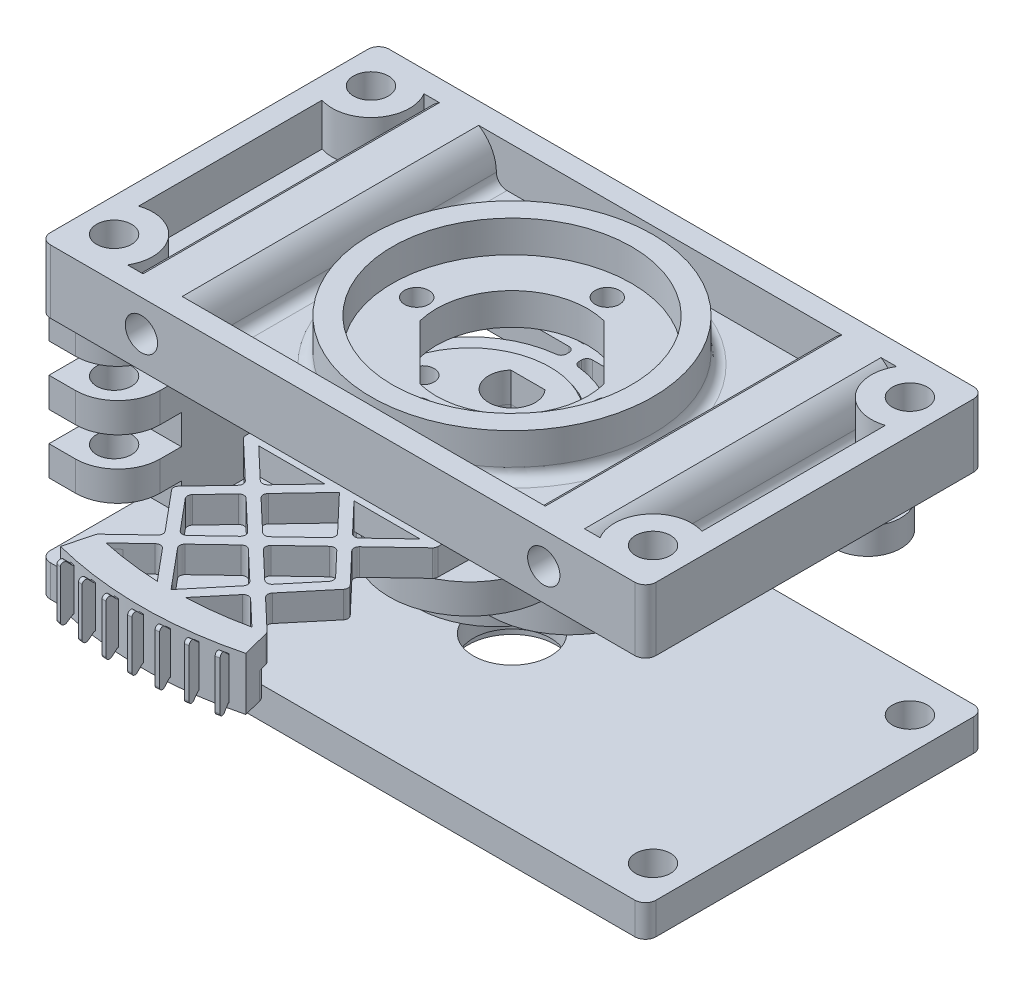
from build123d import *

# Parameters (mm, degrees)
SKETCH4_R                       = 7.8
SKETCH4_R_2                     = 1.65
SKETCH4_W                       = 21.7
SKETCH4_H                       = 1.5
BOSS_EXTRUDE1_DEPTH             = 2.5
EXTRUDE_THIN2_DEPTH             = 2.5
EXTRUDE_THIN2_DEPTH_BACK        = 2.5
EXTRUDE_THIN6_DEPTH             = 2.5
SKETCH7_R                       = 7.6
SKETCH7_R_2                     = 1.1
SKETCH7_R_3                     = 2.2
BOSS_EXTRUDE2_DEPTH             = 2.8
SKETCH7_5_R                     = 7.6
SKETCH7_5_R_2                   = 1.1
SKETCH7_5_R_3                   = 2.2
BOSS_EXTRUDE3_DEPTH             = 2.8
BOSS_EXTRUDE4_START             = -2.8
SKETCH7_6_R                     = 7.6
SKETCH7_6_R_2                   = 1.1
SKETCH7_6_R_3                   = 2.2
BOSS_EXTRUDE4_DEPTH             = 2.8
BOSS_EXTRUDE5_START             = -5.6
SKETCH7_8_R                     = 7.6
SKETCH7_8_R_2                   = 1.1
SKETCH7_8_R_3                   = 2.2
BOSS_EXTRUDE5_DEPTH             = 2.8
BOSS_EXTRUDE6_START             = -8.4
SKETCH7_9_R                     = 7.6
SKETCH7_9_R_2                   = 1.1
SKETCH7_9_R_3                   = 2.2
BOSS_EXTRUDE6_DEPTH             = 2.8
BOSS_EXTRUDE10_START            = -11.2
SKETCH7_10_R                    = 7.6
SKETCH7_10_R_2                  = 1.1
SKETCH7_10_R_3                  = 2.2
BOSS_EXTRUDE10_DEPTH            = 2.8
SKETCH8_W                       = 57.2
SKETCH8_H                       = 32
SKETCH8_R                       = 1.65
BOSS_EXTRUDE7_DEPTH             = 6
CUT_EXTRUDE5_START              = 3
SKETCH9_2_R                     = 11.3
CUT_EXTRUDE5_DEPTH              = 46.220327664
SKETCH9_3_R                     = 1.15
CUT_EXTRUDE6_DEPTH              = 49.220327664
CUT_EXTRUDE1_DEPTH              = 61.12453742
CUT_EXTRUDE1_DEPTH_BACK         = 61.12453742
SKETCH10_R                      = 1.525
FILLET2_R                       = 1
FILLET1_R                       = 0.5
SKETCH12_R                      = 3.15
SKETCH12_R_2                    = 1.65
BOSS_EXTRUDE9_DEPTH             = 2.8
BOSS_EXTRUDE11_START            = -20
SKETCH8_4_W                     = 57.2
SKETCH8_4_H                     = 32
SKETCH8_4_R                     = 1.65
BOSS_EXTRUDE11_DEPTH            = 3
SKETCH13_R                      = 3.65
CUT_EXTRUDE2_DEPTH              = 3
SKETCH13_3_R                    = 4.15
SKETCH13_3_R_2                  = 3.65
CUT_EXTRUDE3_DEPTH              = 0.8
SKETCH14_W                      = 9.130624979
SKETCH14_H                      = 2.8
SKETCH14_W_2                    = 18.261249958
SKETCH14_W_3                    = 6
BOSS_EXTRUDE13_DEPTH            = 6.5
SKETCH8_5_R                     = 1.65
CUT_EXTRUDE4_DEPTH              = 51.714494969
FILLET3_R                       = 4
BOSS_EXTRUDE16_DEPTH            = 2.8
BOSS_EXTRUDE17_DEPTH            = 2.8
BOSS_EXTRUDE18_START            = -2.8
BOSS_EXTRUDE18_DEPTH            = 2.8
BOSS_EXTRUDE19_START            = -5.6
BOSS_EXTRUDE19_DEPTH            = 2.8
BOSS_EXTRUDE20_START            = -8.4
BOSS_EXTRUDE20_DEPTH            = 2.8
BOSS_EXTRUDE21_START            = -11.2
BOSS_EXTRUDE21_DEPTH            = 2.8
SHELL1_START                    = -8.480624879
SHELL1_DEPTH                    = 16.961249758
SHELL1_START_2                  = -14
SHELL1_2_DEPTH                  = 0.6999999
SHELL1_START_3                  = 13.3000001
SHELL1_3_DEPTH                  = 0.6999999
SHELL1_4_DEPTH                  = 28
SHELL1_START_4                  = 4.8
SHELL1_5_OUTLINE_R              = 13.3
SHELL1_5_OUTLINE_R_2            = 11.3
SHELL1_5_DEPTH                  = 4
SHELL1_6_OUTLINE_R              = 11.3
SHELL1_6_OUTLINE_R_2            = 1.15
SHELL1_6_DEPTH                  = 1
SKETCH16_R                      = 0.5
CUT_EXTRUDE8_DEPTH              = 0.2
SKETCH16_2_R                    = 0.5
BOSS_EXTRUDE22_DEPTH            = 0.2
FILLET5_R                       = 0.5
FILLET6_R                       = 0.3
CIRPATTERN2_COUNT               = 4
CIRPATTERN2_ANGLE               = 12
CIRPATTERN2_THE_OTHER_WAY_COUNT = 4
CIRPATTERN2_THE_OTHER_WAY_ANGLE = 12
CIRPATTERN3_ANGLE               = 12
CIRPATTERN3_2_ANGLE             = 8
CIRPATTERN3_3_ANGLE             = 4
CIRPATTERN3_4_ANGLE             = 12
CIRPATTERN3_5_ANGLE             = 8
CIRPATTERN3_6_ANGLE             = 4
SHELL2_START                    = -20.2
SHELL2_OUTLINE_R                = 5.65
SHELL2_DEPTH                    = 1.5
FILLET7_R                       = 1
FILLET8_R                       = 1
FILLET9_R                       = 1
FILLET10_R                      = 1
FILLET11_R                      = 1
FILLET12_R                      = 10


with BuildPart() as part:
    # Sketch4 → Boss-Extrude1 (new body)
    with BuildSketch(Plane(origin=(0, 0, 0), x_dir=(1, 0, 0), z_dir=(0, 1, 0))):
        with BuildLine():
            Line((0.6, 6.480624979), (22.766718427, 6.480624979))
            ThreePointArc((22.766718427, 6.480624979), (28.6, 8.130624979), (22.766718427, 9.780624979))
            Line((22.766718427, 9.780624979), (-22.766718427, 9.780624979))
            ThreePointArc((-22.766718427, 9.780624979), (-28.6, 8.130624979), (-22.766718427, 6.480624979))
            Line((-22.766718427, 6.480624979), (-0.6, 6.480624979))
            Line((-0.6, 6.480624979), (-0.6, 5.280624979))
            ThreePointArc((-0.6, 5.280624979), (-6.843303138, 2.297555253), (-9.298416736, -4.171598965))
            Line((-9.298416736, -4.171598965), (-9.07459142, -16.3))
            Line((-9.07459142, -16.3), (9.07459142, -16.3))
            Line((9.07459142, -16.3), (9.298416736, -4.171598965))
            ThreePointArc((9.298416736, -4.171598965), (6.843303138, 2.297555253), (0.6, 5.280624979))
            Line((0.6, 5.280624979), (0.6, 6.480624979))
        make_face()
        with Locations(Location((0, -4, 0), (0, 0, 270))):
            Circle(SKETCH4_R, mode=Mode.SUBTRACT)
        with Locations(Location((-25.45, 8.130624979, 0), (0, 0, 270))):
            Circle(SKETCH4_R_2, mode=Mode.SUBTRACT)
        with Locations((-11.45, 8.130624979)):
            Rectangle(SKETCH4_W, SKETCH4_H, mode=Mode.SUBTRACT)
        with Locations((11.45, 8.130624979)):
            Rectangle(SKETCH4_W, SKETCH4_H, mode=Mode.SUBTRACT)
        with Locations(Location((25.45, 8.130624979, 0), (0, 0, 270))):
            Circle(SKETCH4_R_2, mode=Mode.SUBTRACT)
    extrude(amount=BOSS_EXTRUDE1_DEPTH)



with BuildPart() as body_2:
    # Sketch4<5> → Extrude-Thin2 (new, two sides: drawn at the far end of the back side and taken through both)
    with BuildSketch(Plane(origin=(0, 0, 0), x_dir=(1, 0, 0), z_dir=(0, 1, 0)).offset(-EXTRUDE_THIN2_DEPTH_BACK)):
        with BuildLine():
            ThreePointArc((-8.75, -33.888604279), (0, -35), (8.75, -33.888604279))
            Line((8.75, -33.888604279), (8.05, -31.177515937))
            ThreePointArc((8.05, -31.177515937), (0, -32.2), (-8.05, -31.177515937))
            Line((-8.05, -31.177515937), (-8.75, -33.888604279))
        make_face()
    extrude(amount=EXTRUDE_THIN2_DEPTH + EXTRUDE_THIN2_DEPTH_BACK)


with BuildPart() as part_1:
    add(part.part)

    add(body_2.part)  # Extrude-Thin6 merges body 2
    # Sketch5 → Extrude-Thin6 (add)
    with BuildSketch(Plane(origin=(0, 0, 0), x_dir=(1, 0, 0), z_dir=(0, 1, 0))):
        Polygon((-8.05, -31.177515937), (8.386109532, -15.574746465), (9.07459142, -16.3), (-7.361518112, -31.902769472), align=None)
        Polygon((0, -16.3), (-7.06229571, -23.738757968), (0, -32.2), (-0.767718557, -32.840787186), (-8.400567994, -23.695972364), (-0.725219651, -15.61148242), align=None)
    extrude_thin6 = extrude(amount=EXTRUDE_THIN6_DEPTH)

    # Mirror1: Extrude-Thin6 across plane
    add(extrude_thin6.mirror(Plane(origin=(0, 0, 0), x_dir=(0, 0, 1), z_dir=(1, 0, 0))))

    # Fillet2
    fillet2_edges = [part_1.edges().sort_by_distance(p)[0] for p in [
        (-8.05, -1.25, 31.177515937),
        (8.05, -1.25, 31.177515937),
    ]]
    fillet(fillet2_edges, radius=FILLET2_R)

    # Fillet1
    fillet1_edges = [part_1.edges().sort_by_distance(p)[0] for p in [
        (-4.761566269, 1.25, 28.05581166),
        (-4.119469828, 1.25, 28.825098817),
        (-3.392734457, 1.25, 28.135210225),
        (-8.400567994, 1.25, 23.695972364),
        (-4.034830898, 1.25, 27.365923067),
        (-7.06229571, 1.25, 23.738757968),
        (-3.613128083, 1.25, 20.105729244),
        (-4.301645663, 1.25, 20.830948896),
        (5.026899199, 1.25, 20.142467008),
        (4.338381619, 1.25, 19.417247356),
        (8.400567994, 1.25, 23.695972364),
        (0, 1.25, 24.914493454),
        (3.392734457, 1.25, 28.135210225),
        (-5.026899199, 1.25, 20.142467008),
        (-4.338381619, 1.25, 19.417247356),
        (0, 1.25, 23.535665291),
        (0.726235517, 1.25, 24.225079372),
        (3.613128083, 1.25, 20.105729244),
        (4.301645663, 1.25, 20.830948896),
        (-0.726235517, 1.25, 24.225079372),
        (4.761566269, 1.25, 28.05581166),
        (8.05, 1.25, 31.177515937),
        (4.034830898, 1.25, 27.365923067),
        (7.06229571, 1.25, 23.738757968),
        (4.119469828, 1.25, 28.825098817),
        (22.766718427, 1.25, -9.780624979),
        (22.766718427, 1.25, -6.480624979),
        (0.6, 1.25, -6.480624979),
        (0.6, 1.25, -5.280624979),
        (9.07459142, 1.25, 16.3),
        (-9.07459142, 1.25, 16.3),
        (-0.6, 1.25, -5.280624979),
        (-0.6, 1.25, -6.480624979),
        (-22.766718427, 1.25, -6.480624979),
        (-22.766718427, 1.25, -9.780624979),
        (-8.05, 1.25, 31.177515937),
    ]]
    fillet(fillet1_edges, radius=FILLET1_R)

    # Sketch16 → Cut-Extrude8 (cut, symmetric)
    with BuildSketch(Plane(origin=(0, 0, 0), x_dir=(0, 0, -1), z_dir=(1, 0, 0))):
        Polygon((-35.1, 2), (-32.1, 2), (-32.1, -2), (-35.1, -2), (-36.1, -3), (-36.1, 3), align=None)
        with Locations((-33.6, 0)):
            Circle(SKETCH16_R, mode=Mode.SUBTRACT)
    cut_extrude8 = extrude(amount=CUT_EXTRUDE8_DEPTH, both=True, mode=Mode.SUBTRACT)

    # CirPattern2: Cut-Extrude8 ×4 about axis
    cirpattern2_axis = Axis((0, 0, 0), (0, 1, 0))
    for i in range(1, CIRPATTERN2_COUNT):
        add(cut_extrude8.rotate(cirpattern2_axis, i * CIRPATTERN2_ANGLE / (CIRPATTERN2_COUNT - 1)), mode=Mode.SUBTRACT)

    # CirPattern2 the other way: Cut-Extrude8 ×4 about axis
    cirpattern2_the_other_way_axis = Axis((0, 0, 0), (0, -1, 0))
    for i in range(1, CIRPATTERN2_THE_OTHER_WAY_COUNT):
        add(cut_extrude8.rotate(cirpattern2_the_other_way_axis, i * CIRPATTERN2_THE_OTHER_WAY_ANGLE / (CIRPATTERN2_THE_OTHER_WAY_COUNT - 1)), mode=Mode.SUBTRACT)

    # Fillet12
    # the kernel refuses this fillet: 10 mm, written as the material it takes off along each edge
    with BuildSketch(Plane(origin=(0.083466419, 2, 32.1), x_dir=(1, 0, 0), z_dir=(0, -1, 0))) as fillet12_piece_1:
        with BuildLine():
            CenterArc((8.580263092, 5.325906756), FILLET12_R, 212.180664035, 7.669879004)
            Line((0.903077523, -1.081965102), (0, 0))
            Line((0, 0), (0.116533581, 0))
        make_face()
    extrude(amount=5.523312979, mode=Mode.SUBTRACT)
    with BuildSketch(Plane(origin=(-0.083466419, 2, 32.1), x_dir=(-0.6407871858448472, 0, -0.7677185568012806), z_dir=(0, -1, 0))) as fillet12_piece_2:
        with BuildLine():
            CenterArc((1.409325192, -10), FILLET12_R, 90, 7.669879004)
            Line((0.074673226, -0.089464993), (0, 0))
            Line((0, 0), (1.409325192, 0))
        make_face()
    extrude(amount=5.523312979, mode=Mode.SUBTRACT)
    with BuildSketch(Plane(origin=(6.80174475, 2, 31.371377618), x_dir=(0.9781476007336182, 0, -0.20791169081864166), z_dir=(0, -1, 0))) as fillet12_piece_3:
        with BuildLine():
            CenterArc((7.659845043, -6.510347586), FILLET12_R, 139.380336254, 6.129720691)
            Line((-0.582410911, -0.847731867), (0, 0))
            Line((0, 0), (0.069365856, 0))
        make_face()
    extrude(amount=4.571298051, mode=Mode.SUBTRACT)
    with BuildSketch(Plane(origin=(-6.80174475, 2, 31.371377618), x_dir=(0.7252535351516691, 0, -0.6884818877428851), z_dir=(0, -1, 0))) as fillet12_piece_4:
        with BuildLine():
            CenterArc((1.028519221, -10), FILLET12_R, 90, 6.129720691)
            Line((-0.039279218, -0.057173114), (0, 0))
            Line((0, 0), (1.028519221, 0))
        make_face()
    extrude(amount=4.571298051, mode=Mode.SUBTRACT)


with BuildPart() as body_2_2:
    # Sketch7 → Boss-Extrude2 (new body)
    with BuildSketch(Plane(origin=(0, 0, 0), x_dir=(1, 0, 0), z_dir=(0, 1, 0))):
        with Locations(Location((0, -4, 0), (0, 0, 270))):
            Circle(SKETCH7_R)
        with Locations(Location((5.354034834, -3.091153453, 0), (0, 0, 270))):
            Circle(SKETCH7_R_2, mode=Mode.SUBTRACT)
        with Locations(Location((-5.354034834, -3.091153453, 0), (0, 0, 270))):
            Circle(SKETCH7_R_2, mode=Mode.SUBTRACT)
        with Locations(Location((0, 0, 0), (0, 0, 270))):
            Circle(SKETCH7_R_3, mode=Mode.SUBTRACT)
    extrude(amount=BOSS_EXTRUDE2_DEPTH)

    # Sketch7<12> → Boss-Extrude16 (add)
    with BuildSketch(Plane(origin=(0, 0, 0), x_dir=(1, 0, 0), z_dir=(0, 1, 0))):
        with BuildLine():
            ThreePointArc((1.609347694, 1.5), (0, 2.2), (-1.609347694, 1.5))
            Line((-1.609347694, 1.5), (1.609347694, 1.5))
        make_face()
    extrude(amount=BOSS_EXTRUDE16_DEPTH)


with BuildPart() as body_3:
    # Sketch7<5> → Boss-Extrude3 (new body)
    with BuildSketch(Plane(origin=(0, 0, 0), x_dir=(1, 0, 0), z_dir=(0, 1, 0))):
        with Locations(Location((3.464101615, 2, 0), (0, 0, 270))):
            Circle(SKETCH7_5_R)
        with Locations(Location((0, 6.182306905, 0), (0, 0, 270))):
            Circle(SKETCH7_5_R_2, mode=Mode.SUBTRACT)
        with Locations(Location((5.354034834, -3.091153453, 0), (0, 0, 270))):
            Circle(SKETCH7_5_R_2, mode=Mode.SUBTRACT)
        with Locations(Location((0, 0, 0), (0, 0, 270))):
            Circle(SKETCH7_5_R_3, mode=Mode.SUBTRACT)
    extrude(amount=-BOSS_EXTRUDE3_DEPTH)

    # Sketch7<14> → Boss-Extrude17 (add)
    with BuildSketch(Plane(origin=(0, 0, 0), x_dir=(1, 0, 0), z_dir=(0, 1, 0))):
        with BuildLine():
            ThreePointArc((1.609347694, 1.5), (0, 2.2), (-1.609347694, 1.5))
            Line((-1.609347694, 1.5), (1.609347694, 1.5))
        make_face()
    extrude(amount=-BOSS_EXTRUDE17_DEPTH)


with BuildPart() as body_4:
    # Sketch7<6> → Boss-Extrude4 (new body)
    with BuildSketch(Plane(origin=(0, 0, 0), x_dir=(1, 0, 0), z_dir=(0, 1, 0)).offset(BOSS_EXTRUDE4_START)):
        with Locations(Location((-3.464101615, 2, 0), (0, 0, 270))):
            Circle(SKETCH7_6_R)
        with Locations(Location((0, 6.182306905, 0), (0, 0, 270))):
            Circle(SKETCH7_6_R_2, mode=Mode.SUBTRACT)
        with Locations(Location((-5.354034834, -3.091153453, 0), (0, 0, 270))):
            Circle(SKETCH7_6_R_2, mode=Mode.SUBTRACT)
        with Locations(Location((0, 0, 0), (0, 0, 270))):
            Circle(SKETCH7_6_R_3, mode=Mode.SUBTRACT)
    extrude(amount=-BOSS_EXTRUDE4_DEPTH)

    # Sketch7<15> → Boss-Extrude18 (add)
    with BuildSketch(Plane(origin=(0, 0, 0), x_dir=(1, 0, 0), z_dir=(0, 1, 0)).offset(BOSS_EXTRUDE18_START)):
        with BuildLine():
            ThreePointArc((1.609347694, 1.5), (0, 2.2), (-1.609347694, 1.5))
            Line((-1.609347694, 1.5), (1.609347694, 1.5))
        make_face()
    extrude(amount=-BOSS_EXTRUDE18_DEPTH)


with BuildPart() as body_5:
    # Sketch7<8> → Boss-Extrude5 (new body)
    with BuildSketch(Plane(origin=(0, 0, 0), x_dir=(1, 0, 0), z_dir=(0, 1, 0)).offset(BOSS_EXTRUDE5_START)):
        with Locations(Location((0, -4, 0), (0, 0, 270))):
            Circle(SKETCH7_8_R)
        with Locations(Location((5.354034834, -3.091153453, 0), (0, 0, 270))):
            Circle(SKETCH7_8_R_2, mode=Mode.SUBTRACT)
        with Locations(Location((-5.354034834, -3.091153453, 0), (0, 0, 270))):
            Circle(SKETCH7_8_R_2, mode=Mode.SUBTRACT)
        with Locations(Location((0, 0, 0), (0, 0, 270))):
            Circle(SKETCH7_8_R_3, mode=Mode.SUBTRACT)
    extrude(amount=-BOSS_EXTRUDE5_DEPTH)

    # Sketch7<16> → Boss-Extrude19 (add)
    with BuildSketch(Plane(origin=(0, 0, 0), x_dir=(1, 0, 0), z_dir=(0, 1, 0)).offset(BOSS_EXTRUDE19_START)):
        with BuildLine():
            ThreePointArc((1.609347694, 1.5), (0, 2.2), (-1.609347694, 1.5))
            Line((-1.609347694, 1.5), (1.609347694, 1.5))
        make_face()
    extrude(amount=-BOSS_EXTRUDE19_DEPTH)


with BuildPart() as body_6:
    # Sketch7<9> → Boss-Extrude6 (new body)
    with BuildSketch(Plane(origin=(0, 0, 0), x_dir=(1, 0, 0), z_dir=(0, 1, 0)).offset(BOSS_EXTRUDE6_START)):
        with Locations(Location((3.464101615, 2, 0), (0, 0, 270))):
            Circle(SKETCH7_9_R)
        with Locations(Location((0, 6.182306905, 0), (0, 0, 270))):
            Circle(SKETCH7_9_R_2, mode=Mode.SUBTRACT)
        with Locations(Location((5.354034834, -3.091153453, 0), (0, 0, 270))):
            Circle(SKETCH7_9_R_2, mode=Mode.SUBTRACT)
        with Locations(Location((0, 0, 0), (0, 0, 270))):
            Circle(SKETCH7_9_R_3, mode=Mode.SUBTRACT)
    extrude(amount=-BOSS_EXTRUDE6_DEPTH)

    # Sketch7<17> → Boss-Extrude20 (add)
    with BuildSketch(Plane(origin=(0, 0, 0), x_dir=(1, 0, 0), z_dir=(0, 1, 0)).offset(BOSS_EXTRUDE20_START)):
        with BuildLine():
            ThreePointArc((1.609347694, 1.5), (0, 2.2), (-1.609347694, 1.5))
            Line((-1.609347694, 1.5), (1.609347694, 1.5))
        make_face()
    extrude(amount=-BOSS_EXTRUDE20_DEPTH)


with BuildPart() as body_7:
    # Sketch7<10> → Boss-Extrude10 (new body)
    with BuildSketch(Plane(origin=(0, 0, 0), x_dir=(1, 0, 0), z_dir=(0, 1, 0)).offset(BOSS_EXTRUDE10_START)):
        with Locations(Location((-3.464101615, 2, 0), (0, 0, 270))):
            Circle(SKETCH7_10_R)
        with Locations(Location((0, 6.182306905, 0), (0, 0, 270))):
            Circle(SKETCH7_10_R_2, mode=Mode.SUBTRACT)
        with Locations(Location((-5.354034834, -3.091153453, 0), (0, 0, 270))):
            Circle(SKETCH7_10_R_2, mode=Mode.SUBTRACT)
        with Locations(Location((0, 0, 0), (0, 0, 270))):
            Circle(SKETCH7_10_R_3, mode=Mode.SUBTRACT)
    extrude(amount=-BOSS_EXTRUDE10_DEPTH)

    # Sketch7<18> → Boss-Extrude21 (add)
    with BuildSketch(Plane(origin=(0, 0, 0), x_dir=(1, 0, 0), z_dir=(0, 1, 0)).offset(BOSS_EXTRUDE21_START)):
        with BuildLine():
            ThreePointArc((1.609347694, 1.5), (0, 2.2), (-1.609347694, 1.5))
            Line((-1.609347694, 1.5), (1.609347694, 1.5))
        make_face()
    extrude(amount=-BOSS_EXTRUDE21_DEPTH)


with BuildPart() as body_8:
    # Sketch8 → Boss-Extrude7 (new body)
    with BuildSketch(Plane(origin=(0, 2.8, 0), x_dir=(1, 0, 0), z_dir=(0, 1, 0))):
        Rectangle(SKETCH8_W, SKETCH8_H)
        with Locations(Location((25.45, 12.130624979, 0), (0, 0, 270))):
            Circle(SKETCH8_R, mode=Mode.SUBTRACT)
        with Locations(Location((-25.45, 12.130624979, 0), (0, 0, 270))):
            Circle(SKETCH8_R, mode=Mode.SUBTRACT)
        with Locations(Location((25.45, -12.130624979, 0), (0, 0, 90))):
            Circle(SKETCH8_R, mode=Mode.SUBTRACT)
        with Locations(Location((-25.45, -12.130624979, 0), (0, 0, 90))):
            Circle(SKETCH8_R, mode=Mode.SUBTRACT)
    extrude(amount=BOSS_EXTRUDE7_DEPTH)

    # Sketch9<2> → Cut-Extrude5 (cut, through all)
    with BuildSketch(Plane(origin=(0, 2.8, 0), x_dir=(1, 0, 0), z_dir=(0, 1, 0)).offset(CUT_EXTRUDE5_START)):
        with Locations(Location((0, 0, 0), (0, 0, 270))):
            Circle(SKETCH9_2_R)
    extrude(amount=CUT_EXTRUDE5_DEPTH, mode=Mode.SUBTRACT)

    # Sketch9<3> → Cut-Extrude6 (cut, through all)
    with BuildSketch(Plane(origin=(0, 2.8, 0), x_dir=(1, 0, 0), z_dir=(0, 1, 0))):
        with BuildLine():
            Line((6.927466096, 1.769947313), (1.769947313, 6.927466096))
            ThreePointArc((1.769947313, 6.927466096), (-5.055813485, 5.055813485), (-6.927466096, -1.769947313))
            Line((-6.927466096, -1.769947313), (-1.769947313, -6.927466096))
            ThreePointArc((-1.769947313, -6.927466096), (5.055813485, -5.055813485), (6.927466096, 1.769947313))
        make_face()
        with Locations(Location((0, 9, 0), (0, 0, 270))):
            Circle(SKETCH9_3_R)
        with Locations(Location((9, 0, 0), (0, 0, 270))):
            Circle(SKETCH9_3_R)
        with Locations(Location((0, -9, 0), (0, 0, 270))):
            Circle(SKETCH9_3_R)
        with Locations(Location((-9, 0, 0), (0, 0, 270))):
            Circle(SKETCH9_3_R)
    extrude(amount=CUT_EXTRUDE6_DEPTH, mode=Mode.SUBTRACT)

    # Sketch10 → Cut-Extrude1 (cut, two sides: drawn at the far end of the back side and taken through both)
    with BuildSketch(Plane(origin=(0, 0, -16), x_dir=(-1, 0, 0), z_dir=(0, 0, -1)).offset(-CUT_EXTRUDE1_DEPTH_BACK)):
        with Locations((-19, 5.8)):
            Circle(SKETCH10_R)
        with Locations((19, 5.8)):
            Circle(SKETCH10_R)
    extrude(amount=CUT_EXTRUDE1_DEPTH + CUT_EXTRUDE1_DEPTH_BACK, mode=Mode.SUBTRACT)

    # Shell1: read off the stored shape, not the designer's step
    # Shell1 outline → Shell1 (cut)
    with BuildSketch(Plane.XY.offset(SHELL1_START)):
        with BuildLine():
            Line((-26.6, 4.8), (-22.380181208, 4.8))
            ThreePointArc((-22.380181208, 4.8), (-22.2925533, 7.058855737), (-20.850844402, 8.8))
            Line((-20.850844402, 8.8), (-26.6, 8.8))
            Line((-26.6, 8.8), (-26.6, 4.8))
        make_face()
        with BuildLine():
            Line((26.6, 8.8), (20.850844402, 8.8))
            ThreePointArc((20.850844402, 8.8), (22.2925533, 7.058855737), (22.380181208, 4.8))
            Line((22.380181208, 4.8), (26.6, 4.8))
            Line((26.6, 4.8), (26.6, 8.8))
        make_face()
    extrude(amount=SHELL1_DEPTH, mode=Mode.SUBTRACT)

    # Shell1 2 outline → Shell1 2 (cut)
    with BuildSketch(Plane.XY.offset(SHELL1_START_2)):
        with BuildLine():
            Line((17.149155598, 8.8), (-17.149155598, 8.8))
            ThreePointArc((-17.149155598, 8.8), (-15.7074467, 7.058855737), (-15.619818792, 4.8))
            Line((-15.619818792, 4.8), (15.619818792, 4.8))
            ThreePointArc((15.619818792, 4.8), (15.7074467, 7.058855737), (17.149155598, 8.8))
        make_face()
    extrude(amount=SHELL1_2_DEPTH, mode=Mode.SUBTRACT)

    # Shell1 3 outline → Shell1 3 (cut)
    with BuildSketch(Plane.XY.offset(SHELL1_START_3)):
        with BuildLine():
            Line((17.149155598, 8.8), (-17.149155598, 8.8))
            ThreePointArc((-17.149155598, 8.8), (-15.7074467, 7.058855737), (-15.619818792, 4.8))
            Line((-15.619818792, 4.8), (15.619818792, 4.8))
            ThreePointArc((15.619818792, 4.8), (15.7074467, 7.058855737), (17.149155598, 8.8))
        make_face()
    extrude(amount=SHELL1_3_DEPTH, mode=Mode.SUBTRACT)

    # Shell1 4 outline → Shell1 4 (cut)
    with BuildSketch(Plane.XY.offset(SHELL1_START_2)):
        with BuildLine():
            Line((-26.6, 4.8), (-22.380181208, 4.8))
            ThreePointArc((-22.380181208, 4.8), (-22.2925533, 7.058855737), (-20.850844402, 8.8))
            Line((-20.850844402, 8.8), (-26.6, 8.8))
            Line((-26.6, 8.8), (-26.6, 4.8))
        make_face()
        with BuildLine():
            Line((26.6, 8.8), (20.850844402, 8.8))
            ThreePointArc((20.850844402, 8.8), (22.2925533, 7.058855737), (22.380181208, 4.8))
            Line((22.380181208, 4.8), (26.6, 4.8))
            Line((26.6, 4.8), (26.6, 8.8))
        make_face()
        with BuildLine():
            Line((17.149155598, 8.8), (-17.149155598, 8.8))
            ThreePointArc((-17.149155598, 8.8), (-15.7074467, 7.058855737), (-15.619818792, 4.8))
            Line((-15.619818792, 4.8), (15.619818792, 4.8))
            ThreePointArc((15.619818792, 4.8), (15.7074467, 7.058855737), (17.149155598, 8.8))
        make_face()
    extrude(amount=SHELL1_4_DEPTH, mode=Mode.SUBTRACT)

    # Shell1 5 outline → Shell1 5 (add)
    # profile 1 of 5: a face of its own
    with BuildSketch(Plane(origin=(0, 0, 0), x_dir=(1, 0, 0), z_dir=(0, 1, 0)).offset(SHELL1_START_4)):
        with BuildLine():
            ThreePointArc((-26.6, 13.313840936), (-23.8, 12.130624979), (-26.6, 10.947409022))
            Line((-26.6, 10.947409022), (-26.6, 8.666523364))
            ThreePointArc((-26.6, 8.666523364), (-22.60456437, 9.844581218), (-22.315045928, 14))
            Line((-22.315045928, 14), (-26.6, 14))
            Line((-26.6, 14), (-26.6, 13.313840936))
        make_face()
    # profile 2 of 5: a face of its own
    with BuildSketch(Plane(origin=(0, 0, 0), x_dir=(1, 0, 0), z_dir=(0, 1, 0)).offset(SHELL1_START_4)):
        with BuildLine():
            ThreePointArc((-22.315045928, -14), (-22.60456437, -9.844581218), (-26.6, -8.666523364))
            Line((-26.6, -8.666523364), (-26.6, -10.947409022))
            ThreePointArc((-26.6, -10.947409022), (-23.8, -12.130624979), (-26.6, -13.313840936))
            Line((-26.6, -13.313840936), (-26.6, -14))
            Line((-26.6, -14), (-22.315045928, -14))
        make_face()
    # profile 3 of 5: a face of its own
    with BuildSketch(Plane(origin=(0, 0, 0), x_dir=(1, 0, 0), z_dir=(0, 1, 0)).offset(SHELL1_START_4)):
        with BuildLine():
            Line((26.6, -10.947409022), (26.6, -8.666523364))
            ThreePointArc((26.6, -8.666523364), (22.60456437, -9.844581218), (22.315045928, -14))
            Line((22.315045928, -14), (26.6, -14))
            Line((26.6, -14), (26.6, -13.313840936))
            ThreePointArc((26.6, -13.313840936), (23.8, -12.130624979), (26.6, -10.947409022))
        make_face()
    # profile 4 of 5: a face of its own
    with BuildSketch(Plane(origin=(0, 0, 0), x_dir=(1, 0, 0), z_dir=(0, 1, 0)).offset(SHELL1_START_4)):
        with BuildLine():
            ThreePointArc((26.6, 10.947409022), (23.8, 12.130624979), (26.6, 13.313840936))
            Line((26.6, 13.313840936), (26.6, 14))
            Line((26.6, 14), (22.315045928, 14))
            ThreePointArc((22.315045928, 14), (22.60456437, 9.844581218), (26.6, 8.666523364))
            Line((26.6, 8.666523364), (26.6, 10.947409022))
        make_face()
    # profile 5 of 5: a face of its own
    with BuildSketch(Plane(origin=(0, 0, 0), x_dir=(1, 0, 0), z_dir=(0, 1, 0)).offset(SHELL1_START_4)):
        Circle(SHELL1_5_OUTLINE_R)
        Circle(SHELL1_5_OUTLINE_R_2, mode=Mode.SUBTRACT)
    extrude(amount=SHELL1_5_DEPTH)

    # Shell1 6 outline → Shell1 6 (add)
    with BuildSketch(Plane(origin=(0, 0, 0), x_dir=(1, 0, 0), z_dir=(0, 1, 0)).offset(SHELL1_START_4)):
        Circle(SHELL1_6_OUTLINE_R)
        with Locations((0, -9)):
            Circle(SHELL1_6_OUTLINE_R_2, mode=Mode.SUBTRACT)
        with Locations((-9, 0)):
            Circle(SHELL1_6_OUTLINE_R_2, mode=Mode.SUBTRACT)
        with BuildLine():
            Line((-1.769947313, -6.927466096), (-6.927466096, -1.769947313))
            ThreePointArc((-6.927466096, -1.769947313), (-5.055813485, 5.055813485), (1.769947313, 6.927466096))
            Line((1.769947313, 6.927466096), (6.927466096, 1.769947313))
            ThreePointArc((6.927466096, 1.769947313), (5.055813485, -5.055813485), (-1.769947313, -6.927466096))
        make_face(mode=Mode.SUBTRACT)
        with Locations((0, 9)):
            Circle(SHELL1_6_OUTLINE_R_2, mode=Mode.SUBTRACT)
        with Locations((9, 0)):
            Circle(SHELL1_6_OUTLINE_R_2, mode=Mode.SUBTRACT)
    extrude(amount=SHELL1_6_DEPTH)

    # Fillet9
    # the kernel refuses this fillet: 1 mm, written as the material it adds along each edge
    with BuildSketch(Plane(origin=(-22.380181208, 4.8, -13.018156174), x_dir=(-0.14332366385263956, 0.9896758698583367, 0), z_dir=(0, 0, 1)), Plane(origin=(22.380181208, 4.8, 13.018156174), x_dir=(0.14332366385263945, 0.9896758698583369, 0), z_dir=(0, 0, -1))) as fillet9_piece_1:
        with BuildLine():
            CenterArc((1.153755494, 0.98967587), FILLET9_R, 171.759781695, 90.000000003)
            Line((0.164079624, 1.132999534), (0, 0))
            ThreePointArc((0, 0), (0.505215915, 0.036392559), (1.01043183, 0))
        make_face()
    extrude(amount=26.036312347)
    with BuildSketch(Plane(origin=(-15.619818792, 4.8, 14), x_dir=(0.14332366385264117, 0.9896758698583367, 0), z_dir=(0, 0, -1)), Plane(origin=(15.619818792, 4.8, -14), x_dir=(-0.14332366385263795, 0.9896758698583369, 0), z_dir=(0, 0, 1))) as fillet9_piece_2:
        with BuildLine():
            CenterArc((1.153755494, 0.98967587), FILLET9_R, 171.759781695, 90.000000003)
            Line((0.164079624, 1.132999534), (0, 0))
            ThreePointArc((0, 0), (0.505215915, 0.036392559), (1.01043183, 0))
        make_face()
    extrude(amount=28)
    with BuildSketch(Plane(origin=(0, 4.8, 0), x_dir=(1, 0, 0), z_dir=(0, 0, 1))) as fillet9_piece_3:
        with BuildLine():
            CenterArc((13.3 + FILLET9_R, FILLET9_R), FILLET9_R, 180, 90)
            Line((13.3, FILLET9_R), (13.3, 0))
            Line((13.3, 0), (13.3 + FILLET9_R, 0))
        make_face()
    revolve(axis=Axis((0, 4.8, 0), (0, 1, 0)))

    # Fillet11
    fillet11_edges = [body_8.edges().sort_by_distance(p)[0] for p in [
        (28.6, 5.8, -16),
        (28.6, 5.8, 16),
        (-28.6, 5.8, 16),
        (-28.6, 5.8, -16),
    ]]
    fillet(fillet11_edges, radius=FILLET11_R)


with BuildPart() as body_9:
    # Sketch12 → Boss-Extrude9 (new body)
    with BuildSketch(Plane.XZ):
        with Locations(Location((-25.45, -8.130624979, 0), (0, 0, 270))):
            Circle(SKETCH12_R)
        with Locations(Location((-25.45, -8.130624979, 0), (0, 0, 270))):
            Circle(SKETCH12_R_2, mode=Mode.SUBTRACT)
    extrude(amount=BOSS_EXTRUDE9_DEPTH)


with BuildPart() as body_10:
    # Sketch8<4> → Boss-Extrude11 (new body)
    with BuildSketch(Plane(origin=(0, 2.8, 0), x_dir=(1, 0, 0), z_dir=(0, 1, 0)).offset(BOSS_EXTRUDE11_START)):
        Rectangle(SKETCH8_4_W, SKETCH8_4_H)
        with Locations(Location((25.45, 12.130624979, 0), (0, 0, 270))):
            Circle(SKETCH8_4_R, mode=Mode.SUBTRACT)
        with Locations(Location((-25.45, 12.130624979, 0), (0, 0, 270))):
            Circle(SKETCH8_4_R, mode=Mode.SUBTRACT)
        with Locations(Location((25.45, -12.130624979, 0), (0, 0, 90))):
            Circle(SKETCH8_4_R, mode=Mode.SUBTRACT)
        with Locations(Location((-25.45, -12.130624979, 0), (0, 0, 90))):
            Circle(SKETCH8_4_R, mode=Mode.SUBTRACT)
    extrude(amount=-BOSS_EXTRUDE11_DEPTH)

    # Sketch13 → Cut-Extrude2 (cut)
    with BuildSketch(Plane.XZ.offset(20.2)):
        with Locations(Location((0, 0, 0), (0, 0, 270))):
            Circle(SKETCH13_R)
    extrude(amount=-CUT_EXTRUDE2_DEPTH, mode=Mode.SUBTRACT)

    # Sketch13<3> → Cut-Extrude3 (cut)
    with BuildSketch(Plane.XZ.offset(20.2)):
        with Locations(Location((0, 0, 0), (0, 0, 270))):
            Circle(SKETCH13_3_R)
        with Locations(Location((0, 0, 0), (0, 0, 270))):
            Circle(SKETCH13_3_R_2, mode=Mode.SUBTRACT)
    extrude(amount=-CUT_EXTRUDE3_DEPTH, mode=Mode.SUBTRACT)

    # Shell2: read off the stored shape, not the designer's step
    # Shell2 outline → Shell2 (cut)
    with BuildSketch(Plane(origin=(0, 0, 0), x_dir=(1, 0, 0), z_dir=(0, 1, 0)).offset(SHELL2_START)):
        with BuildLine():
            ThreePointArc((-23.374292407, 14.5), (-22.914720646, 10.261170888), (-27.1, 9.447343406))
            Line((-27.1, 9.447343406), (-27.1, -9.447343406))
            ThreePointArc((-27.1, -9.447343406), (-22.914720646, -10.261170888), (-23.374292407, -14.5))
            Line((-23.374292407, -14.5), (23.374292407, -14.5))
            ThreePointArc((23.374292407, -14.5), (22.914720646, -10.261170888), (27.1, -9.447343406))
            Line((27.1, -9.447343406), (27.1, 9.447343406))
            ThreePointArc((27.1, 9.447343406), (22.914720646, 10.261170888), (23.374292407, 14.5))
            Line((23.374292407, 14.5), (-23.374292407, 14.5))
        make_face()
        Circle(SHELL2_OUTLINE_R, mode=Mode.SUBTRACT)
    extrude(amount=SHELL2_DEPTH, mode=Mode.SUBTRACT)

    # Fillet7
    fillet7_edges = [body_10.edges().sort_by_distance(p)[0] for p in [
        (-27.1, -19.45, -9.447343406),
        (-27.1, -19.45, 9.447343406),
        (-23.374292407, -19.45, -14.5),
        (27.1, -19.45, -9.447343406),
        (27.1, -19.45, 9.447343406),
        (23.374292407, -19.45, 14.5),
        (23.374292407, -19.45, -14.5),
        (-23.374292407, -19.45, 14.5),
    ]]
    fillet(fillet7_edges, radius=FILLET7_R)

    # Fillet8
    fillet8_edges = [body_10.edges().sort_by_distance(p)[0] for p in [
        (-5.65, -18.7, 0),
        (-23.032446024, -18.7, 10.111235771),
        (-27.1, -18.7, 0),
        (-23.032446024, -18.7, -10.111235771),
        (0, -18.7, -14.5),
        (23.032446024, -18.7, -10.111235771),
        (27.1, -18.7, 0),
        (23.032446024, -18.7, 10.111235771),
        (0, -18.7, 14.5),
        (22.347901532, -18.7, -14.078804853),
        (-22.347901532, -18.7, 14.078804853),
        (22.347901532, -18.7, 14.078804853),
        (26.749374119, -18.7, 8.792313773),
        (26.749374119, -18.7, -8.792313773),
        (-22.347901532, -18.7, -14.078804853),
        (-26.749374119, -18.7, -8.792313773),
        (-26.749374119, -18.7, 8.792313773),
    ]]
    fillet(fillet8_edges, radius=FILLET8_R)

    # Fillet10
    fillet10_edges = [body_10.edges().sort_by_distance(p)[0] for p in [
        (-28.6, -18.7, -16),
        (28.6, -18.7, -16),
        (28.6, -18.7, 16),
        (-28.6, -18.7, 16),
    ]]
    fillet(fillet10_edges, radius=FILLET10_R)


with BuildPart() as body_11:
    # Sketch14 → Boss-Extrude13 (new body)
    with BuildSketch(Plane.ZY.offset(28.6)):
        with Locations((-4.56531249, 1.4)):
            Rectangle(SKETCH14_W, SKETCH14_H)
        with Locations((4.56531249, 1.4)):
            Rectangle(SKETCH14_W, SKETCH14_H)
        Polygon((0, 0), (-9.130624979, 0), (-9.130624979, -2.8), (9.130624979, -2.8), (9.130624979, 0), align=None)
        with Locations((0, -4.2)):
            Rectangle(SKETCH14_W_2, SKETCH14_H)
        with Locations((0, -7)):
            Rectangle(SKETCH14_W_2, SKETCH14_H)
        with Locations((0, -9.8)):
            Rectangle(SKETCH14_W_2, SKETCH14_H)
        with Locations((0, -12.6)):
            Rectangle(SKETCH14_W_2, SKETCH14_H)
        with Locations((-12.130624979, -1.4)):
            Rectangle(SKETCH14_W_3, SKETCH14_H)
        with Locations((12.130624979, 1.4)):
            Rectangle(SKETCH14_W_3, SKETCH14_H)
        with Locations((12.130624979, -4.2)):
            Rectangle(SKETCH14_W_3, SKETCH14_H)
        with Locations((-12.130624979, -7)):
            Rectangle(SKETCH14_W_3, SKETCH14_H)
        with Locations((12.130624979, -9.8)):
            Rectangle(SKETCH14_W_3, SKETCH14_H)
        with Locations((-12.130624979, -12.6)):
            Rectangle(SKETCH14_W_3, SKETCH14_H)
    extrude(amount=-BOSS_EXTRUDE13_DEPTH)

    # Sketch8<5> → Cut-Extrude4 (cut, through all)
    with BuildSketch(Plane(origin=(0, 2.8, 0), x_dir=(1, 0, 0), z_dir=(0, 1, 0))):
        with Locations(Location((-25.45, 12.130624979, 0), (0, 0, 270))):
            Circle(SKETCH8_5_R)
        with Locations(Location((-25.45, -12.130624979, 0), (0, 0, 90))):
            Circle(SKETCH8_5_R)
    extrude(amount=-CUT_EXTRUDE4_DEPTH, mode=Mode.SUBTRACT)

    # Fillet3
    fillet3_edges = [body_11.edges().sort_by_distance(p)[0] for p in [
        (-22.1, -9.8, 15.130624979),
        (-22.1, -4.2, 15.130624979),
        (-22.1, 1.4, 15.130624979),
        (-22.1, -1.4, -15.130624979),
        (-22.1, -7, -15.130624979),
        (-22.1, -12.6, -15.130624979),
    ]]
    fillet(fillet3_edges, radius=FILLET3_R)


with BuildPart() as body_12:
    # Sketch16<2> → Boss-Extrude22 (new, symmetric)
    with BuildSketch(Plane(origin=(0, 0, 0), x_dir=(0, 0, -1), z_dir=(1, 0, 0))):
        Polygon((-35.1, 2), (-32.1, 2), (-32.1, -2), (-35.1, -2), (-36.1, -3), (-36.1, 3), align=None)
        with Locations((-33.6, 0)):
            Circle(SKETCH16_2_R, mode=Mode.SUBTRACT)
    extrude(amount=BOSS_EXTRUDE22_DEPTH, both=True)

    # Fillet5
    fillet5_edges = [body_12.edges().sort_by_distance(p)[0] for p in [
        (0, 2, 32.1),
        (0, -2, 32.1),
    ]]
    fillet(fillet5_edges, radius=FILLET5_R)

    # Fillet6
    fillet6_edges = [body_12.edges().sort_by_distance(p)[0] for p in [
        (0, -3, 36.1),
        (0, 3, 36.1),
    ]]
    fillet(fillet6_edges, radius=FILLET6_R)


with BuildPart() as body_13:
    # CirPattern3: read off the stored shape, not the designer's step
    # CirPattern3: copy of body 12
    add(body_12.part.rotate(Axis((0, 0, 0), (0, -1, 0)), CIRPATTERN3_ANGLE))


with BuildPart() as body_14:
    # CirPattern3 2: copy of body 12
    add(body_12.part.rotate(Axis((0, 0, 0), (0, -1, 0)), CIRPATTERN3_2_ANGLE))


with BuildPart() as body_15:
    # CirPattern3 3: copy of body 12
    add(body_12.part.rotate(Axis((0, 0, 0), (0, -1, 0)), CIRPATTERN3_3_ANGLE))


with BuildPart() as body_16:
    # CirPattern3 4: copy of body 12
    add(body_12.part.rotate(Axis((0, 0, 0), (0, 1, 0)), CIRPATTERN3_4_ANGLE))


with BuildPart() as body_17:
    # CirPattern3 5: copy of body 12
    add(body_12.part.rotate(Axis((0, 0, 0), (0, 1, 0)), CIRPATTERN3_5_ANGLE))


with BuildPart() as body_18:
    # CirPattern3 6: copy of body 12
    add(body_12.part.rotate(Axis((0, 0, 0), (0, 1, 0)), CIRPATTERN3_6_ANGLE))


solid = Compound([part_1.part, body_2_2.part, body_3.part, body_4.part, body_5.part, body_6.part, body_7.part, body_8.part, body_9.part, body_10.part, body_11.part, body_12.part, body_13.part, body_14.part, body_15.part, body_16.part, body_17.part, body_18.part])
